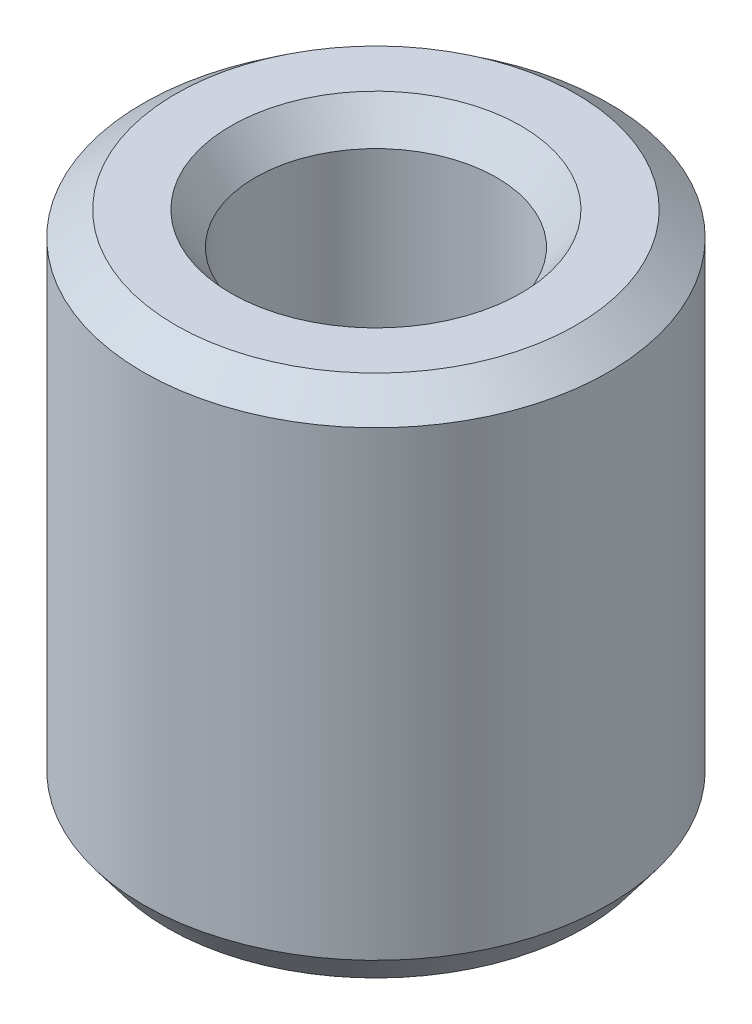
from build123d import *
from OCP.BRepFilletAPI import BRepFilletAPI_MakeChamfer

# Parameters (mm, degrees)
SKETCH1_R           = 5
BOSS_EXTRUDE1_DEPTH = 11.127756593
SKETCH2_R           = 2.59056989
CUT_EXTRUDE1_DEPTH  = 14.18434552
CHAMFER1_SIZE       = 0.523870374
CHAMFER1_SIZE2      = 0.698186209


with BuildPart() as part:
    # Sketch1 → Boss-Extrude1 (new body)
    with BuildSketch(Plane(origin=(0, 0, 0), x_dir=(1, 0, 0), z_dir=(0, 1, 0))):
        Circle(SKETCH1_R)
    extrude(amount=BOSS_EXTRUDE1_DEPTH)

    # Sketch2 → Cut-Extrude1 (cut, through all)
    with BuildSketch(Plane(origin=(0, 0, 0), x_dir=(1, 0, 0), z_dir=(0, 1, 0))):
        Circle(SKETCH2_R)
    extrude(amount=CUT_EXTRUDE1_DEPTH, mode=Mode.SUBTRACT)

    # Chamfer1: one chamfer whose edges measure the first distance from different faces: ONE call of the kernel's chamfer builder (chamfer() names one face for all edges)
    chamfer1_edges_1 = [part.edges().sort_by_distance(p)[0] for p in [
        (-2.59056989, 11.127756593, 0),
    ]]
    chamfer1_side_1 = [part.faces().sort_by_distance(p)[0] for p in [
        (-4.858578644, 11.127756593, 0),
    ]]
    chamfer1_edges_2 = [part.edges().sort_by_distance(p)[0] for p in [
        (-2.59056989, 0, 0),
    ]]
    chamfer1_side_2 = [part.faces().sort_by_distance(p)[0] for p in [
        (-2.59056989, 5.563878297, 0),
    ]]
    chamfer1_edges_3 = [part.edges().sort_by_distance(p)[0] for p in [
        (-5, 0, 0),
    ]]
    chamfer1_side_3 = [part.faces().sort_by_distance(p)[0] for p in [
        (-4.858578644, 0, 0),
    ]]
    chamfer1_edges_4 = [part.edges().sort_by_distance(p)[0] for p in [
        (-5, 11.127756593, 0),
    ]]
    chamfer1_side_4 = [part.faces().sort_by_distance(p)[0] for p in [
        (-5, 5.563878297, 0),
    ]]
    chamfer1 = BRepFilletAPI_MakeChamfer(part.part.solid().wrapped)
    for e in chamfer1_edges_1:
        chamfer1.Add(CHAMFER1_SIZE, CHAMFER1_SIZE2, e.wrapped, chamfer1_side_1[0].wrapped)  # the first distance lies on this face
    for e in chamfer1_edges_2:
        chamfer1.Add(CHAMFER1_SIZE, CHAMFER1_SIZE2, e.wrapped, chamfer1_side_2[0].wrapped)  # the first distance lies on this face
    for e in chamfer1_edges_3:
        chamfer1.Add(CHAMFER1_SIZE, CHAMFER1_SIZE2, e.wrapped, chamfer1_side_3[0].wrapped)  # the first distance lies on this face
    for e in chamfer1_edges_4:
        chamfer1.Add(CHAMFER1_SIZE, CHAMFER1_SIZE2, e.wrapped, chamfer1_side_4[0].wrapped)  # the first distance lies on this face
    add(Compound.cast(chamfer1.Shape()), mode=Mode.REPLACE)


solid = part.part
